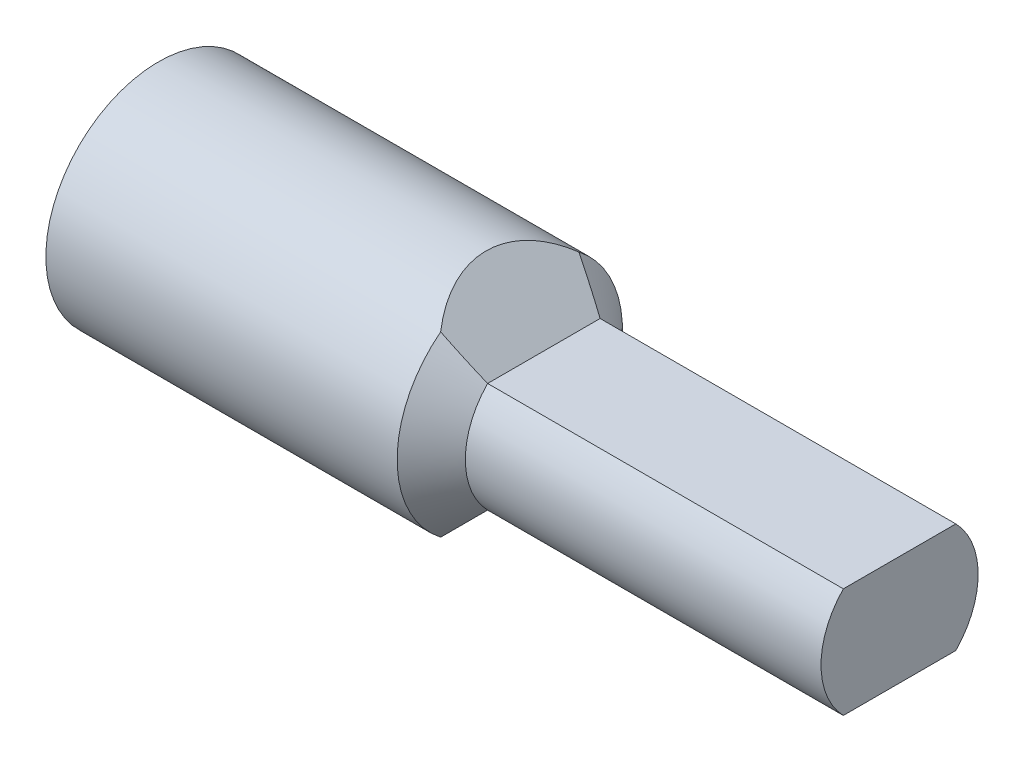
from build123d import *

# Parameters (mm, degrees)
SALIENTE_EXTRUIR1_DEPTH      = 16
SALIENTE_EXTRUIR2_DEPTH      = 2
SALIENTE_EXTRUIR2_DEPTH_BACK = 9
CROQUIS2_R                   = 3.8
SALIENTE_EXTRUIR3_DEPTH      = 2
CHAFL_N1_SIZE                = 2


with BuildPart() as part:
    # Croquis1 → Saliente-Extruir1 (new body)
    with BuildSketch(Plane(origin=(0, 0, 0), x_dir=(0, 0, -1), z_dir=(1, 0, 0))):
        with BuildLine():
            Line((-1.897366596, 1.85), (1.897366596, 1.85))
            ThreePointArc((1.897366596, 1.85), (2.65, 0), (1.897366596, -1.85))
            Line((1.897366596, -1.85), (-1.897366596, -1.85))
            ThreePointArc((-1.897366596, -1.85), (-2.65, 0), (-1.897366596, 1.85))
        make_face()
    extrude(amount=SALIENTE_EXTRUIR1_DEPTH)

    # Croquis2 → Saliente-Extruir2 (add, two sides: drawn at the far end of the back side and taken through both)
    with BuildSketch(Plane(origin=(0, 0, 0), x_dir=(0, 0, -1), z_dir=(1, 0, 0)).offset(-SALIENTE_EXTRUIR2_DEPTH_BACK)):
        Circle(CROQUIS2_R)
        with BuildLine():
            Line((1.7, 1.549193338), (1.7, -1.549193338))
            ThreePointArc((1.7, -1.549193338), (-2.3, 0), (1.7, 1.549193338))
        make_face(mode=Mode.SUBTRACT)
    extrude(amount=SALIENTE_EXTRUIR2_DEPTH + SALIENTE_EXTRUIR2_DEPTH_BACK)

    # Croquis3 → Saliente-Extruir3 (add)
    with BuildSketch(Plane(origin=(0, 0, 0), x_dir=(0, 0, -1), z_dir=(1, 0, 0))):
        with BuildLine():
            Line((-1.897366596, 1.85), (1.897366596, 1.85))
            ThreePointArc((1.897366596, 1.85), (0, 2.65), (-1.897366596, 1.85))
        make_face()
        with BuildLine():
            Line((-1.897366596, -1.85), (1.897366596, -1.85))
            ThreePointArc((1.897366596, -1.85), (0, -2.65), (-1.897366596, -1.85))
        make_face()
    extrude(amount=SALIENTE_EXTRUIR3_DEPTH)

    # Chaflán1
    # the kernel refuses this chamfer: 2 mm, written as the material it adds along each edge
    with BuildSketch(Plane(origin=(2, 0, 0), x_dir=(0, 0.4143114997605186, 0.91013514445174), z_dir=(0, -0.91013514445174, 0.4143114997605186))) as chafl_n1_piece_1_section:
        Polygon((2.65, -CHAFL_N1_SIZE), (2.65 + CHAFL_N1_SIZE, 0), (2.65, 0), align=None)
    chafl_n1_piece_1 = revolve(axis=Axis((2, 0, 0), (-1, 0, 0)), revolution_arc=311.048068347, mode=Mode.PRIVATE)
    chafl_n1_piece_1 = split(chafl_n1_piece_1, bisect_by=Plane(origin=(2, 1.85, 0), z_dir=(0, -1, 0)), keep=Keep.TOP, mode=Mode.PRIVATE)
    chafl_n1_piece_1 = split(chafl_n1_piece_1, bisect_by=Plane(origin=(2, -1.85, 0), z_dir=(0, 1, 0)), keep=Keep.TOP, mode=Mode.PRIVATE)
    chafl_n1_piece_1 = chafl_n1_piece_1 & Plane(origin=(2, 0, 0), x_dir=(0, 0, -1), z_dir=(-1, 0, 0)) * Cylinder(3.8, 19, mode=Mode.PRIVATE)
    add(chafl_n1_piece_1)
    with BuildSketch(Plane(origin=(2, -1.85, -7.040732572), x_dir=(1, 0, 0), z_dir=(0, 0, 1))) as chafl_n1_piece_2_section:
        Polygon((CHAFL_N1_SIZE, 0), (0, -CHAFL_N1_SIZE), (0, 0), align=None)
    chafl_n1_piece_2 = extrude(amount=14.081465144, mode=Mode.PRIVATE)
    chafl_n1_piece_2 = chafl_n1_piece_2 & Plane(origin=(2, 0, 0), x_dir=(0, 0.6981132075471701, -0.7159873947551046), z_dir=(-1, 0, 0)) * Cylinder(2.65, 37, mode=Mode.PRIVATE)
    add(chafl_n1_piece_2)
    with BuildSketch(Plane(origin=(2, 0, 0), x_dir=(0, -0.4143114997605186, -0.91013514445174), z_dir=(0, 0.91013514445174, -0.4143114997605186))) as chafl_n1_piece_3_section:
        Polygon((2.65, -CHAFL_N1_SIZE), (2.65 + CHAFL_N1_SIZE, 0), (2.65, 0), align=None)
    chafl_n1_piece_3 = revolve(axis=Axis((2, 0, 0), (-1, 0, 0)), revolution_arc=311.048068347, mode=Mode.PRIVATE)
    chafl_n1_piece_3 = split(chafl_n1_piece_3, bisect_by=Plane(origin=(2, 1.85, 0), z_dir=(0, -1, 0)), keep=Keep.TOP, mode=Mode.PRIVATE)
    chafl_n1_piece_3 = split(chafl_n1_piece_3, bisect_by=Plane(origin=(2, -1.85, 0), z_dir=(0, 1, 0)), keep=Keep.TOP, mode=Mode.PRIVATE)
    chafl_n1_piece_3 = chafl_n1_piece_3 & Plane(origin=(2, 0, 0), x_dir=(0, 0, -1), z_dir=(-1, 0, 0)) * Cylinder(3.8, 19, mode=Mode.PRIVATE)
    add(chafl_n1_piece_3)
    with BuildSketch(Plane(origin=(2, 1.85, -7.040732572), x_dir=(1, 0, 0), z_dir=(0, 0, 1))) as chafl_n1_piece_4_section:
        Polygon((CHAFL_N1_SIZE, 0), (0, CHAFL_N1_SIZE), (0, 0), align=None)
    chafl_n1_piece_4 = extrude(amount=14.081465144, mode=Mode.PRIVATE)
    chafl_n1_piece_4 = chafl_n1_piece_4 & Plane(origin=(2, 0, 0), x_dir=(0, -0.6981132075471701, 0.7159873947551046), z_dir=(-1, 0, 0)) * Cylinder(2.65, 37, mode=Mode.PRIVATE)
    add(chafl_n1_piece_4)
    with BuildSketch(Plane(origin=(2, 1.85, -7.040732572), x_dir=(1, 0, 0), z_dir=(0, 0, 1))) as chafl_n1_piece_5a_section:
        Polygon((CHAFL_N1_SIZE, 0), (0, CHAFL_N1_SIZE), (0, 0), align=None)
    chafl_n1_piece_5a = extrude(amount=14.081465144, mode=Mode.PRIVATE)
    chafl_n1_piece_5a = chafl_n1_piece_5a - Plane(origin=(2, 0, 0), x_dir=(0, -0.6981132075471701, 0.7159873947551046), z_dir=(-1, 0, 0)) * Cylinder(2.65, 37, mode=Mode.PRIVATE)
    chafl_n1_piece_5a = chafl_n1_piece_5a & Plane(origin=(2, 0, 0), x_dir=(0, 0, -1), z_dir=(-1, 0, 0)) * Cylinder(3.8, 37, mode=Mode.PRIVATE)
    with BuildSketch(Plane(origin=(2, 0, 0), x_dir=(0, 0.4143114997605186, 0.91013514445174), z_dir=(0, -0.91013514445174, 0.4143114997605186))) as chafl_n1_piece_5b_section:
        Polygon((2.65, -CHAFL_N1_SIZE), (2.65 + CHAFL_N1_SIZE, 0), (2.65, 0), align=None)
    chafl_n1_piece_5b = revolve(axis=Axis((2, 0, 0), (-1, 0, 0)), revolution_arc=311.048068347, mode=Mode.PRIVATE)
    chafl_n1_piece_5b = split(chafl_n1_piece_5b, bisect_by=Plane(origin=(2, 1.85, 0), z_dir=(0, 1, 0)), keep=Keep.TOP, mode=Mode.PRIVATE)
    chafl_n1_piece_5b = chafl_n1_piece_5b & Plane(origin=(2, 0, 0), x_dir=(0, 0, -1), z_dir=(-1, 0, 0)) * Cylinder(3.8, 19, mode=Mode.PRIVATE)
    chafl_n1_piece_5 = chafl_n1_piece_5a & chafl_n1_piece_5b
    add(chafl_n1_piece_5)
    with BuildSketch(Plane(origin=(2, 0, 0), x_dir=(0, 0.4143114997605186, 0.91013514445174), z_dir=(0, -0.91013514445174, 0.4143114997605186))) as chafl_n1_piece_6a_section:
        Polygon((2.65, -CHAFL_N1_SIZE), (2.65 + CHAFL_N1_SIZE, 0), (2.65, 0), align=None)
    chafl_n1_piece_6a = revolve(axis=Axis((2, 0, 0), (-1, 0, 0)), revolution_arc=311.048068347, mode=Mode.PRIVATE)
    chafl_n1_piece_6a = split(chafl_n1_piece_6a, bisect_by=Plane(origin=(2, -1.85, 0), z_dir=(0, -1, 0)), keep=Keep.TOP, mode=Mode.PRIVATE)
    chafl_n1_piece_6a = chafl_n1_piece_6a & Plane(origin=(2, 0, 0), x_dir=(0, 0, -1), z_dir=(-1, 0, 0)) * Cylinder(3.8, 19, mode=Mode.PRIVATE)
    with BuildSketch(Plane(origin=(2, -1.85, -7.040732572), x_dir=(1, 0, 0), z_dir=(0, 0, 1))) as chafl_n1_piece_6b_section:
        Polygon((CHAFL_N1_SIZE, 0), (0, -CHAFL_N1_SIZE), (0, 0), align=None)
    chafl_n1_piece_6b = extrude(amount=14.081465144, mode=Mode.PRIVATE)
    chafl_n1_piece_6b = chafl_n1_piece_6b - Plane(origin=(2, 0, 0), x_dir=(0, 0.6981132075471701, -0.7159873947551046), z_dir=(-1, 0, 0)) * Cylinder(2.65, 37, mode=Mode.PRIVATE)
    chafl_n1_piece_6b = chafl_n1_piece_6b & Plane(origin=(2, 0, 0), x_dir=(0, 0, -1), z_dir=(-1, 0, 0)) * Cylinder(3.8, 37, mode=Mode.PRIVATE)
    chafl_n1_piece_6 = chafl_n1_piece_6a & chafl_n1_piece_6b
    add(chafl_n1_piece_6)
    with BuildSketch(Plane(origin=(2, -1.85, -7.040732572), x_dir=(1, 0, 0), z_dir=(0, 0, 1))) as chafl_n1_piece_7a_section:
        Polygon((CHAFL_N1_SIZE, 0), (0, -CHAFL_N1_SIZE), (0, 0), align=None)
    chafl_n1_piece_7a = extrude(amount=14.081465144, mode=Mode.PRIVATE)
    chafl_n1_piece_7a = chafl_n1_piece_7a - Plane(origin=(2, 0, 0), x_dir=(0, 0.6981132075471701, -0.7159873947551046), z_dir=(-1, 0, 0)) * Cylinder(2.65, 37, mode=Mode.PRIVATE)
    chafl_n1_piece_7a = chafl_n1_piece_7a & Plane(origin=(2, 0, 0), x_dir=(0, 0, -1), z_dir=(-1, 0, 0)) * Cylinder(3.8, 37, mode=Mode.PRIVATE)
    with BuildSketch(Plane(origin=(2, 0, 0), x_dir=(0, -0.4143114997605186, -0.91013514445174), z_dir=(0, 0.91013514445174, -0.4143114997605186))) as chafl_n1_piece_7b_section:
        Polygon((2.65, -CHAFL_N1_SIZE), (2.65 + CHAFL_N1_SIZE, 0), (2.65, 0), align=None)
    chafl_n1_piece_7b = revolve(axis=Axis((2, 0, 0), (-1, 0, 0)), revolution_arc=311.048068347, mode=Mode.PRIVATE)
    chafl_n1_piece_7b = split(chafl_n1_piece_7b, bisect_by=Plane(origin=(2, -1.85, 0), z_dir=(0, -1, 0)), keep=Keep.TOP, mode=Mode.PRIVATE)
    chafl_n1_piece_7b = chafl_n1_piece_7b & Plane(origin=(2, 0, 0), x_dir=(0, 0, -1), z_dir=(-1, 0, 0)) * Cylinder(3.8, 19, mode=Mode.PRIVATE)
    chafl_n1_piece_7 = chafl_n1_piece_7a & chafl_n1_piece_7b
    add(chafl_n1_piece_7)
    with BuildSketch(Plane(origin=(2, 1.85, -7.040732572), x_dir=(1, 0, 0), z_dir=(0, 0, 1))) as chafl_n1_piece_8a_section:
        Polygon((CHAFL_N1_SIZE, 0), (0, CHAFL_N1_SIZE), (0, 0), align=None)
    chafl_n1_piece_8a = extrude(amount=14.081465144, mode=Mode.PRIVATE)
    chafl_n1_piece_8a = chafl_n1_piece_8a - Plane(origin=(2, 0, 0), x_dir=(0, -0.6981132075471701, 0.7159873947551046), z_dir=(-1, 0, 0)) * Cylinder(2.65, 37, mode=Mode.PRIVATE)
    chafl_n1_piece_8a = chafl_n1_piece_8a & Plane(origin=(2, 0, 0), x_dir=(0, 0, -1), z_dir=(-1, 0, 0)) * Cylinder(3.8, 37, mode=Mode.PRIVATE)
    with BuildSketch(Plane(origin=(2, 0, 0), x_dir=(0, -0.4143114997605186, -0.91013514445174), z_dir=(0, 0.91013514445174, -0.4143114997605186))) as chafl_n1_piece_8b_section:
        Polygon((2.65, -CHAFL_N1_SIZE), (2.65 + CHAFL_N1_SIZE, 0), (2.65, 0), align=None)
    chafl_n1_piece_8b = revolve(axis=Axis((2, 0, 0), (-1, 0, 0)), revolution_arc=311.048068347, mode=Mode.PRIVATE)
    chafl_n1_piece_8b = split(chafl_n1_piece_8b, bisect_by=Plane(origin=(2, 1.85, 0), z_dir=(0, 1, 0)), keep=Keep.TOP, mode=Mode.PRIVATE)
    chafl_n1_piece_8b = chafl_n1_piece_8b & Plane(origin=(2, 0, 0), x_dir=(0, 0, -1), z_dir=(-1, 0, 0)) * Cylinder(3.8, 19, mode=Mode.PRIVATE)
    chafl_n1_piece_8 = chafl_n1_piece_8a & chafl_n1_piece_8b
    add(chafl_n1_piece_8)

    # Chaflán2: read off the stored shape, not the designer's step
    # Chaflán2 outline → Chaflán2 (revolve)
    with BuildSketch(Plane.YX):
        Polygon((2.3, 0), (1.3, 0), (2.3, -1), align=None)
    revolve(axis=Axis((0, 0, 0), (1, 0, 0)))


solid = part.part
